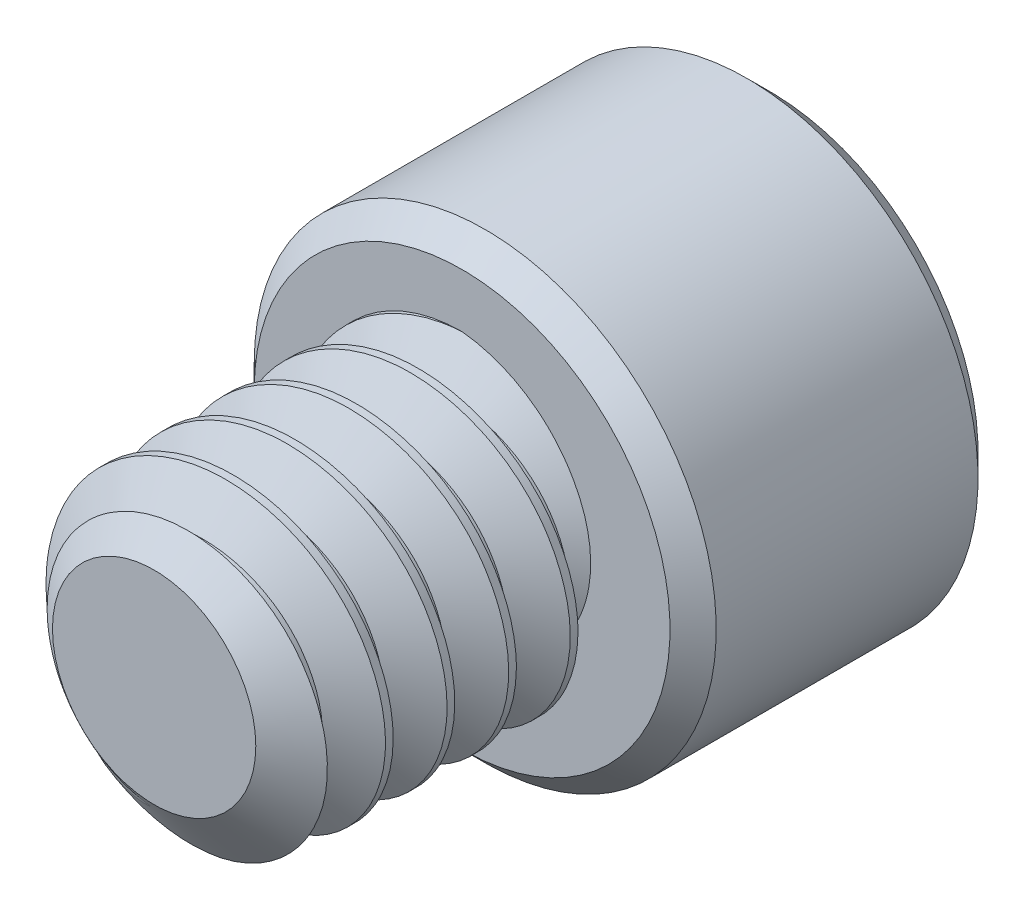
from build123d import *

# Parameters (mm, degrees)
SKETCH1_R          = 3.175
EXTRUDE1_DEPTH     = 6.35
CUT_SWEEP1_PITCH   = 1.27
SKETCH6_R          = 4.7625
EXTRUDE2_DEPTH     = 6.35
CUT_EXTRUDE1_DEPTH = 3.571875
CHAMFER1_SIZE      = 0.47625


with BuildPart() as part:
    # Sketch1 → Extrude1 (new body)
    with BuildSketch(Plane.XY):
        Circle(SKETCH1_R)
    extrude(amount=-EXTRUDE1_DEPTH)

    # Cut-Sweep1: the profile of Sketch3 profile screwed along a right-hand helix of 6 turns, 6 arcs to a turn; built about Z, then put on its axis
    cut_sweep1_z = Axis((0, 0, 0), (0, 0, 1))
    cut_sweep1_corners = [(3.1753, 0, -1.111423205), (2.350110803, 0, -0.635), (2.350110803, 0, -0.47625), (3.1753, 0, 0.000173205)]
    with BuildLine(mode=Mode.PRIVATE) as cut_sweep1_profile:
        Line(cut_sweep1_corners[0], cut_sweep1_corners[1])
        Line(cut_sweep1_corners[1], cut_sweep1_corners[2])
        Line(cut_sweep1_corners[2], cut_sweep1_corners[3])
        Line(cut_sweep1_corners[3], cut_sweep1_corners[0])
    cut_sweep1_cap = Face(cut_sweep1_profile.wire())
    cut_sweep1_turn_angles = [0, 30, 60, 90, 120, 150, 180, 210, 240, 270, 300, 330, 360]
    cut_sweep1_turn_weights = [1, 0.8660254037844387, 1, 0.8660254037844387, 1, 0.8660254037844387, 1, 0.8660254037844387, 1, 0.8660254037844387, 1, 0.8660254037844387, 1]
    cut_sweep1_turn_rails = [Edge.make_bspline([Vector(p[0], p[1], 0).rotate(cut_sweep1_z, cut_sweep1_turn_angles[k]) / cut_sweep1_turn_weights[k] + Vector(0, 0, p[2] + CUT_SWEEP1_PITCH * cut_sweep1_turn_angles[k] / 360) for k in range(13)], [0, 0, 0, 1, 1, 2, 2, 3, 3, 4, 4, 5, 5, 6, 6, 6], 2, cut_sweep1_turn_weights) for p in cut_sweep1_corners]
    cut_sweep1_turn_sides = [Face.make_surface_from_curves(cut_sweep1_turn_rails[p[0]], cut_sweep1_turn_rails[p[1]]) for p in [(0, 1), (1, 2), (2, 3), (3, 0)]]
    cut_sweep1 = Plane(origin=(0, 0, 0), x_dir=(0, 1, 0), z_dir=(0, 0, -1)) * Solid(Shell([*[p.moved(Location((0, 0, CUT_SWEEP1_PITCH * i))) for i in range(6) for p in cut_sweep1_turn_sides], cut_sweep1_cap, cut_sweep1_cap.rotate(cut_sweep1_z, 2160).moved(Location((0, 0, CUT_SWEEP1_PITCH * 2160 / 360)))]))
    add(cut_sweep1, mode=Mode.SUBTRACT)

    # Sketch4 → Cut-Revolve1 (revolve, cut)
    with BuildSketch(Plane(origin=(0, 0, 0), x_dir=(0, 0, -1), z_dir=(1, 0, 0)), mode=Mode.PRIVATE) as cut_revolve1_sk:
        Polygon((0.755446349, 3.175), (0, 2.096110803), (0, 3.175), align=None)
    revolve(cut_revolve1_sk.sketch.rotate(Axis((0, 0, 0), (0, 0, -1)), 229.892048011), axis=Axis((0, 0, 0), (0, 0, -1)), mode=Mode.SUBTRACT)

    # Sketch6 → Extrude2 (add)
    with BuildSketch(Plane(origin=(0, 0, -6.35), x_dir=(-1, 0, 0), z_dir=(0, 0, -1))):
        Circle(SKETCH6_R)
    extrude(amount=EXTRUDE2_DEPTH)

    # Sketch7 → Cut-Extrude1 (cut)
    with BuildSketch(Plane(origin=(0, 0, -12.7), x_dir=(-1, 0, 0), z_dir=(0, 0, -1))):
        Polygon((0, 2.749630657), (-2.38125, 1.374815329), (-2.38125, -1.374815329), (0, -2.749630657), (2.38125, -1.374815329), (2.38125, 1.374815329), align=None)
    extrude(amount=-CUT_EXTRUDE1_DEPTH, mode=Mode.SUBTRACT)

    # Cut-Extrude2 cone 1 section (through the dimple's axis) → Cut-Extrude2 (revolve, cut)
    with BuildSketch(Plane(origin=(0, 0, -12.7), x_dir=(0, 1, 0), z_dir=(1, 0, 0))):
        Polygon((0, 0), (2.749630657, 0), (0, 2.749630657), align=None)
    revolve(axis=Axis((0, 0, -12.7), (0, 0, 1)), mode=Mode.SUBTRACT)

    # Chamfer1
    chamfer1_edges = [part.edges().sort_by_distance(p)[0] for p in [
        (4.7625, 0, -6.35),
        (4.7625, 0, -12.7),
    ]]
    chamfer(chamfer1_edges, length=CHAMFER1_SIZE)


solid = part.part
